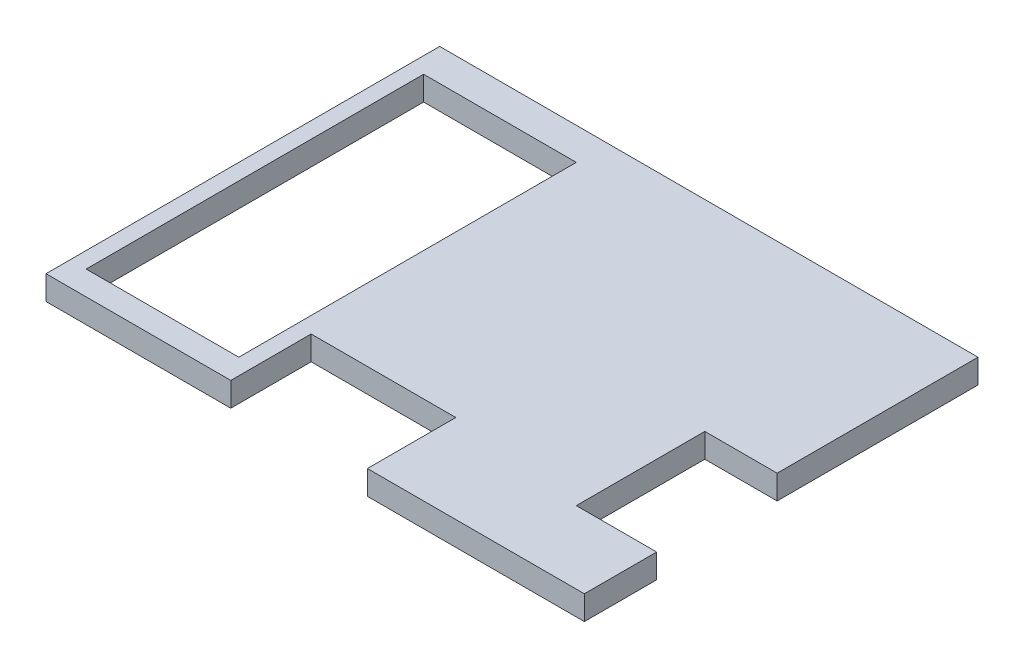
from build123d import *

# Parameters (mm, degrees)
SKETCH1_W           = 19
SKETCH1_H           = 42
BOSS_EXTRUDE1_DEPTH = 3


with BuildPart() as part:
    # Sketch1 → Boss-Extrude1 (new body)
    with BuildSketch(Plane(origin=(0, 0, 0), x_dir=(1, 0, 0), z_dir=(0, 1, 0))):
        Polygon((-33.410916291, -24.434849228), (-10.410916291, -24.434849228), (-10.410916291, -14.432604124), (7.590734464, -14.432604124), (7.590734464, -25.432604124), (34.590734464, -25.432604124), (34.590734464, -16.432604124), (24.589083709, -16.432604124), (24.589083709, -0.434849228), (33.589083709, -0.434849228), (33.589083709, 24.565150772), (-33.410916291, 24.565150772), align=None)
        with Locations((-21.910916291, -0.434849228)):
            Rectangle(SKETCH1_W, SKETCH1_H, mode=Mode.SUBTRACT)
    extrude(amount=BOSS_EXTRUDE1_DEPTH)


solid = part.part
